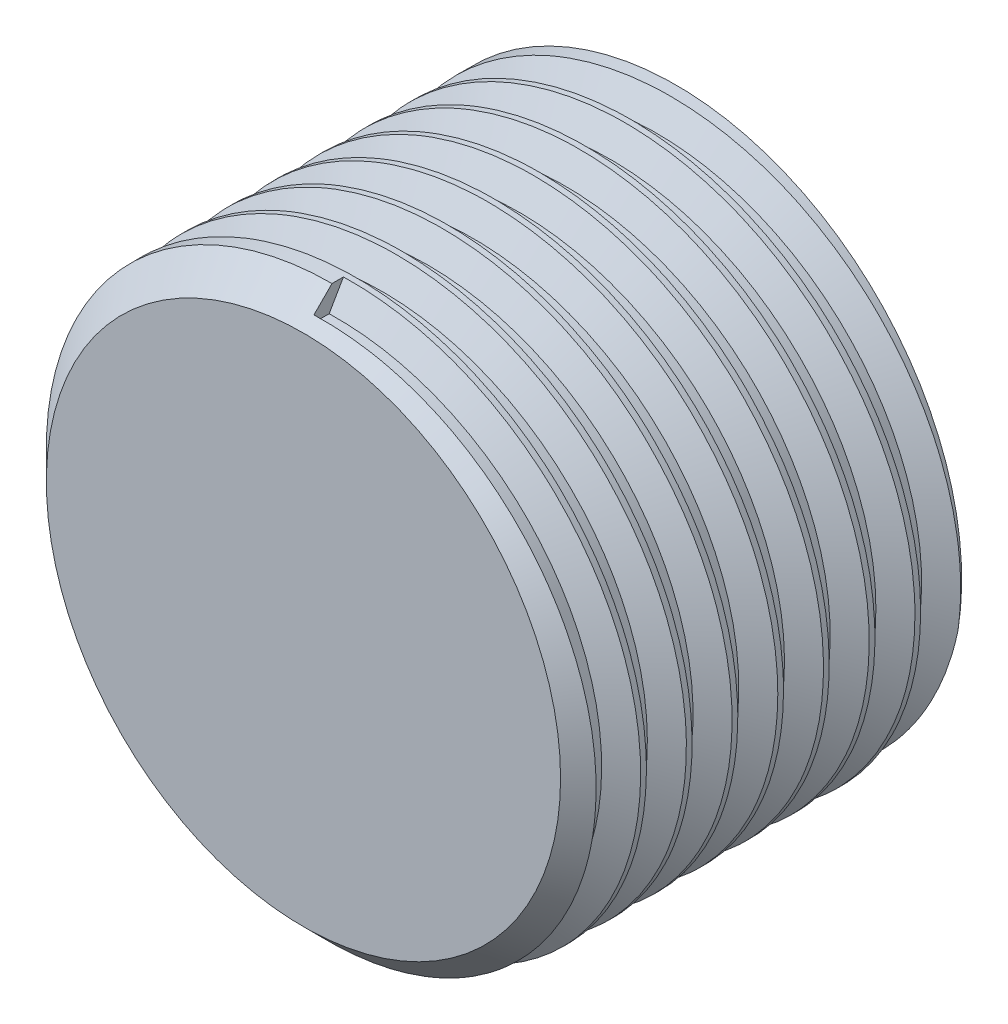
from build123d import *

# Parameters (mm, degrees)
SKETCH_2_R          = 5
EXTRUDE_1_DEPTH     = 6.52
CHAMFER_4_SIZE      = 0.5
THREAD_1_PITCH      = 0.8
SKETCH_25_W         = 1.6
SKETCH_25_H         = 6.5
CUT_EXTRUDE_1_DEPTH = 1


with BuildPart() as part:
    # Эскиз2 → Бобышка-Вытянуть1 (new body)
    with BuildSketch(Plane.XY):
        Circle(SKETCH_2_R)
    extrude(amount=EXTRUDE_1_DEPTH)

    # Chamfer 4
    chamfer_4_edges = [part.edges().sort_by_distance(p)[0] for p in [
        (-5, 0, 6.52),
    ]]
    chamfer(chamfer_4_edges, length=CHAMFER_4_SIZE)

    # Резьба1: the profile of Профиль резьбы1 profile screwed along a right-hand helix of 7.5 turns, 8 arcs to a turn; built about Z, then put on its axis
    thread_1_z = Axis((0, 0, 0), (0, 0, 1))
    thread_1_corners = [(5.0003, 0, -0.000173205), (5.0003, 0, 0.700173203), (4.5669873, 0, 0.449999999), (4.5669873, 0, 0.249999999)]
    with BuildLine(mode=Mode.PRIVATE) as thread_1_profile:
        Line(thread_1_corners[0], thread_1_corners[1])
        Line(thread_1_corners[1], thread_1_corners[2])
        Line(thread_1_corners[2], thread_1_corners[3])
        Line(thread_1_corners[3], thread_1_corners[0])
    thread_1_cap = Face(thread_1_profile.wire())
    thread_1_turn_angles = [0, 22.5, 45, 67.5, 90, 112.5, 135, 157.5, 180, 202.5, 225, 247.5, 270, 292.5, 315, 337.5, 360]
    thread_1_turn_weights = [1, 0.9238795325112867, 1, 0.9238795325112867, 1, 0.9238795325112867, 1, 0.9238795325112867, 1, 0.9238795325112867, 1, 0.9238795325112867, 1, 0.9238795325112867, 1, 0.9238795325112867, 1]
    thread_1_turn_rails = [Edge.make_bspline([Vector(p[0], p[1], 0).rotate(thread_1_z, thread_1_turn_angles[k]) / thread_1_turn_weights[k] + Vector(0, 0, p[2] + THREAD_1_PITCH * thread_1_turn_angles[k] / 360) for k in range(17)], [0, 0, 0, 1, 1, 2, 2, 3, 3, 4, 4, 5, 5, 6, 6, 7, 7, 8, 8, 8], 2, thread_1_turn_weights) for p in thread_1_corners]
    thread_1_turn_sides = [Face.make_surface_from_curves(thread_1_turn_rails[p[0]], thread_1_turn_rails[p[1]]) for p in [(0, 1), (1, 2), (2, 3), (3, 0)]]
    thread_1_last_angles = [2520, 2542.5, 2565, 2587.5, 2610, 2632.5, 2655, 2677.5, 2700]
    thread_1_last_weights = [1, 0.9238795325112867, 1, 0.9238795325112867, 1, 0.9238795325112867, 1, 0.9238795325112867, 1]
    thread_1_last_rails = [Edge.make_bspline([Vector(p[0], p[1], 0).rotate(thread_1_z, thread_1_last_angles[k]) / thread_1_last_weights[k] + Vector(0, 0, p[2] + THREAD_1_PITCH * thread_1_last_angles[k] / 360) for k in range(9)], [0, 0, 0, 1, 1, 2, 2, 3, 3, 4, 4, 4], 2, thread_1_last_weights) for p in thread_1_corners]
    thread_1_last_sides = [Face.make_surface_from_curves(thread_1_last_rails[p[0]], thread_1_last_rails[p[1]]) for p in [(0, 1), (1, 2), (2, 3), (3, 0)]]
    thread_1 = Plane(origin=(0, 0, 6.52), x_dir=(0, 1, 0), z_dir=(0, 0, -1)) * Solid(Shell([*[p.moved(Location((0, 0, THREAD_1_PITCH * i))) for i in range(7) for p in thread_1_turn_sides], *thread_1_last_sides, thread_1_cap, thread_1_cap.rotate(thread_1_z, 2700).moved(Location((0, 0, THREAD_1_PITCH * 2700 / 360)))]))
    add(thread_1, mode=Mode.SUBTRACT)

    # Эскиз25 → Вырез-Вытянуть1 (cut)
    with BuildSketch(Plane(origin=(0, 0, 0), x_dir=(-1, 0, 0), z_dir=(0, 0, -1))):
        with Locations((-0.010817193, 0.07107036)):
            Rectangle(SKETCH_25_W, SKETCH_25_H)
    extrude(amount=-CUT_EXTRUDE_1_DEPTH, mode=Mode.SUBTRACT)


solid = part.part
